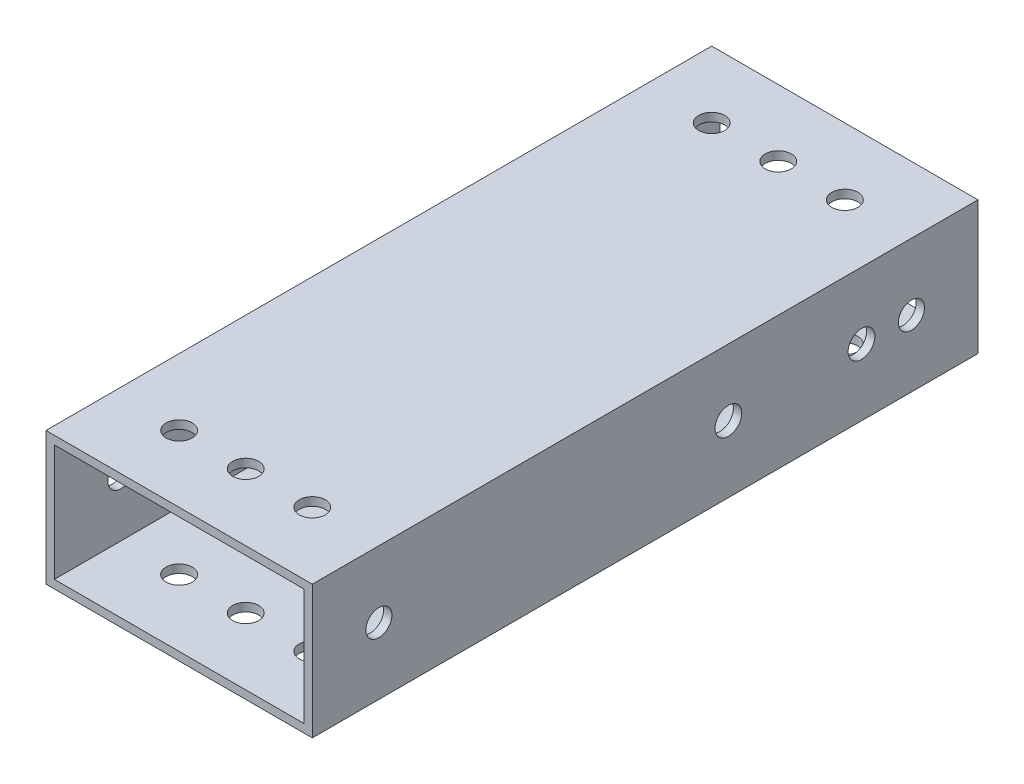
from build123d import *

# Parameters (mm, degrees)
SKETCH1_W           = 50.8
SKETCH1_H           = 25.4
SKETCH1_W_2         = 47.625
SKETCH1_H_2         = 22.225
BOSS_EXTRUDE1_DEPTH = 63.5
SKETCH2_R           = 2.4892
CUT_EXTRUDE1_DEPTH  = 73.955945611
SKETCH3_R           = 2.4892
CUT_EXTRUDE2_DEPTH  = 83.30540687
SKETCH5_R           = 2.5527
CUT_EXTRUDE3_DEPTH  = 83.30540687


with BuildPart() as part:
    # Sketch1 → Boss-Extrude1 (new, symmetric)
    with BuildSketch(Plane.XY):
        Rectangle(SKETCH1_W, SKETCH1_H)
        Rectangle(SKETCH1_W_2, SKETCH1_H_2, mode=Mode.SUBTRACT)
    extrude(amount=BOSS_EXTRUDE1_DEPTH, both=True)

    # Sketch2 → Cut-Extrude1 (cut, through all)
    with BuildSketch(Plane(origin=(0, 12.7, 0), x_dir=(1, 0, 0), z_dir=(0, 1, 0))):
        with Locations((-12.7, 50.8)):
            Circle(SKETCH2_R)
        with Locations((0, 50.8)):
            Circle(SKETCH2_R)
        with Locations((12.7, 50.8)):
            Circle(SKETCH2_R)
        with Locations((12.7, -50.8)):
            Circle(SKETCH2_R)
        with Locations((0, -50.8)):
            Circle(SKETCH2_R)
        with Locations((-12.7, -50.8)):
            Circle(SKETCH2_R)
    extrude(amount=-CUT_EXTRUDE1_DEPTH, mode=Mode.SUBTRACT)

    # Sketch3 → Cut-Extrude2 (cut, through all)
    with BuildSketch(Plane.ZY.offset(25.4)):
        with Locations((-50.8, 0)):
            Circle(SKETCH3_R)
        with Locations((50.8, 0)):
            Circle(SKETCH3_R)
    extrude(amount=-CUT_EXTRUDE2_DEPTH, mode=Mode.SUBTRACT)

    # Sketch5 → Cut-Extrude3 (cut, through all)
    with BuildSketch(Plane(origin=(25.4, 0, 0), x_dir=(0, 0, -1), z_dir=(1, 0, 0))):
        with Locations((41.275, 0)):
            Circle(SKETCH5_R)
        with Locations((15.875, 0)):
            Circle(SKETCH5_R)
    extrude(amount=-CUT_EXTRUDE3_DEPTH, mode=Mode.SUBTRACT)


solid = part.part
